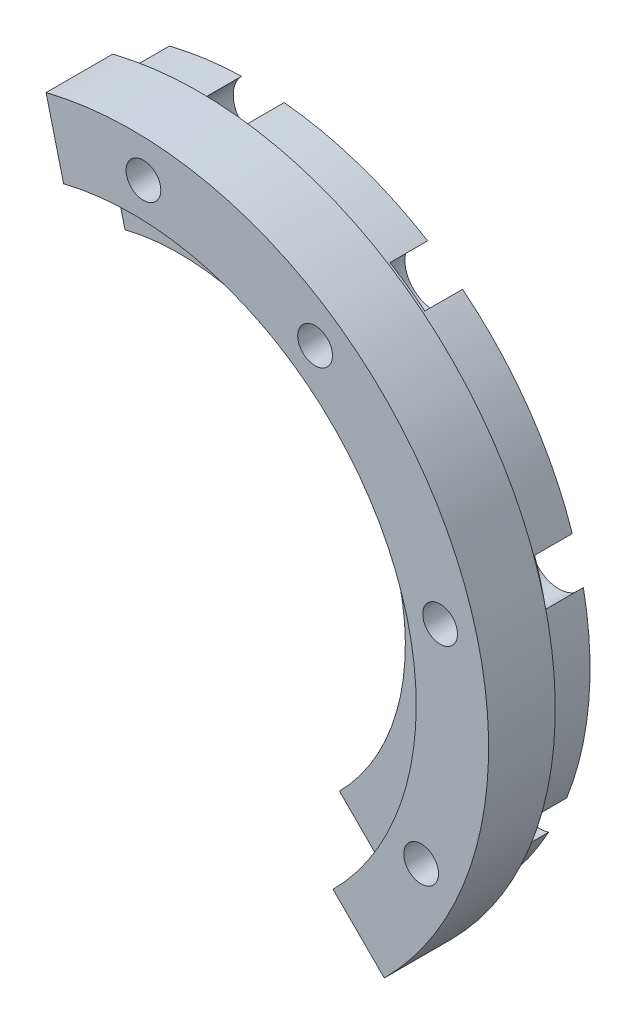
from build123d import *

# Parameters (mm, degrees)
BOSS_1_DEPTH  = 5.6
BOSS_2_DEPTH  = 4.95
CUT_3_DEPTH   = 1.1
S_HOLE4_R     = 1.2
HOLE_4_DEPTH  = 8.4
S_HOLE5_R     = 2
HOLE_5_DEPTH  = 2.7
S_HOLE6_R     = 1.2
HOLE_6_DEPTH  = 8.4
S_HOLE7_R     = 2
HOLE_7_DEPTH  = 2.7
S_HOLE8_R     = 1.2
HOLE_8_DEPTH  = 8.4
S_HOLE9_R     = 2
HOLE_9_DEPTH  = 2.7
S_HOLE10_R    = 1.2
HOLE_10_DEPTH = 8.4
S_HOLE11_R    = 2
HOLE_11_DEPTH = 2.7


with BuildPart() as part:
    # S_prism1 → Boss_1 (new body)
    with BuildSketch(Plane.XY.offset(24.6)):
        with BuildLine():
            Line((-5.951278632, 23.869274866), (-4.741669154, 19.017796235))
            ThreePointArc((-4.741669154, 19.017796235), (17.05897164, 9.651501778), (13.859292911, -13.859292911))
            Line((13.859292911, -13.859292911), (17.394826817, -17.394826817))
            ThreePointArc((17.394826817, -17.394826817), (21.41075012, 12.113619579), (-5.951278632, 23.869274866))
        make_face()
    extrude(amount=BOSS_1_DEPTH)

    # S_prism2 → Boss_2 (add)
    with BuildSketch(Plane.XY.offset(22)):
        with BuildLine():
            Line((-5.633228846, 22.711819231), (-3.755485898, 15.14121282))
            ThreePointArc((-3.755485898, 15.14121282), (13.577548857, 7.681807538), (11.044334296, -11.017380812))
            Line((11.044334296, -11.017380812), (16.566501443, -16.526071219))
            ThreePointArc((16.566501443, -16.526071219), (20.366323285, 11.522711306), (-5.633228846, 22.711819231))
        make_face()
    extrude(amount=BOSS_2_DEPTH)

    # S_pcut3 → Cut_3 (cut)
    with BuildSketch(Plane.XY.offset(24.5)):
        with BuildLine():
            Line((-6.418712319, 23.954960492), (-6.056365655, 22.602664335))
            ThreePointArc((-6.056365655, 22.602664335), (20.366323285, 11.522711306), (16.255005869, -16.832551328))
            Line((16.255005869, -16.832551328), (17.227527587, -17.839627048))
            ThreePointArc((17.227527587, -17.839627048), (21.584821259, 12.212104291), (-6.418712319, 23.954960492))
        make_face()
    extrude(amount=CUT_3_DEPTH, mode=Mode.SUBTRACT)

    # S_hole4 → Hole_4 (cut)
    with BuildSketch(Plane.XY.offset(21.9)):
        with Locations((19.938771315, -9.297601758)):
            Circle(S_HOLE4_R)
    extrude(amount=HOLE_4_DEPTH, mode=Mode.SUBTRACT)

    # S_hole5 → Hole_5 (cut)
    with BuildSketch(Plane.XY.offset(21.9)):
        with Locations((19.938771315, -9.297601758)):
            Circle(S_HOLE5_R)
    extrude(amount=HOLE_5_DEPTH, mode=Mode.SUBTRACT)

    # S_hole6 → Hole_6 (cut)
    with BuildSketch(Plane.XY.offset(21.9)):
        with Locations((21.250368178, 5.694018992)):
            Circle(S_HOLE6_R)
    extrude(amount=HOLE_6_DEPTH, mode=Mode.SUBTRACT)

    # S_hole7 → Hole_7 (cut)
    with BuildSketch(Plane.XY.offset(21.9)):
        with Locations((21.250368178, 5.694018992)):
            Circle(S_HOLE7_R)
    extrude(amount=HOLE_7_DEPTH, mode=Mode.SUBTRACT)

    # S_hole8 → Hole_8 (cut)
    with BuildSketch(Plane.XY.offset(21.9)):
        with Locations((12.6186816, 18.021344974)):
            Circle(S_HOLE8_R)
    extrude(amount=HOLE_8_DEPTH, mode=Mode.SUBTRACT)

    # S_hole9 → Hole_9 (cut)
    with BuildSketch(Plane.XY.offset(21.9)):
        with Locations((12.6186816, 18.021344974)):
            Circle(S_HOLE9_R)
    extrude(amount=HOLE_9_DEPTH, mode=Mode.SUBTRACT)

    # S_hole10 → Hole_10 (cut)
    with BuildSketch(Plane.XY.offset(21.9)):
        with Locations((0.767788927, 21.986598194)):
            Circle(S_HOLE10_R)
    extrude(amount=HOLE_10_DEPTH, mode=Mode.SUBTRACT)

    # S_hole11 → Hole_11 (cut)
    with BuildSketch(Plane.XY.offset(21.9)):
        with Locations((0.767788927, 21.986598194)):
            Circle(S_HOLE11_R)
    extrude(amount=HOLE_11_DEPTH, mode=Mode.SUBTRACT)


solid = part.part
